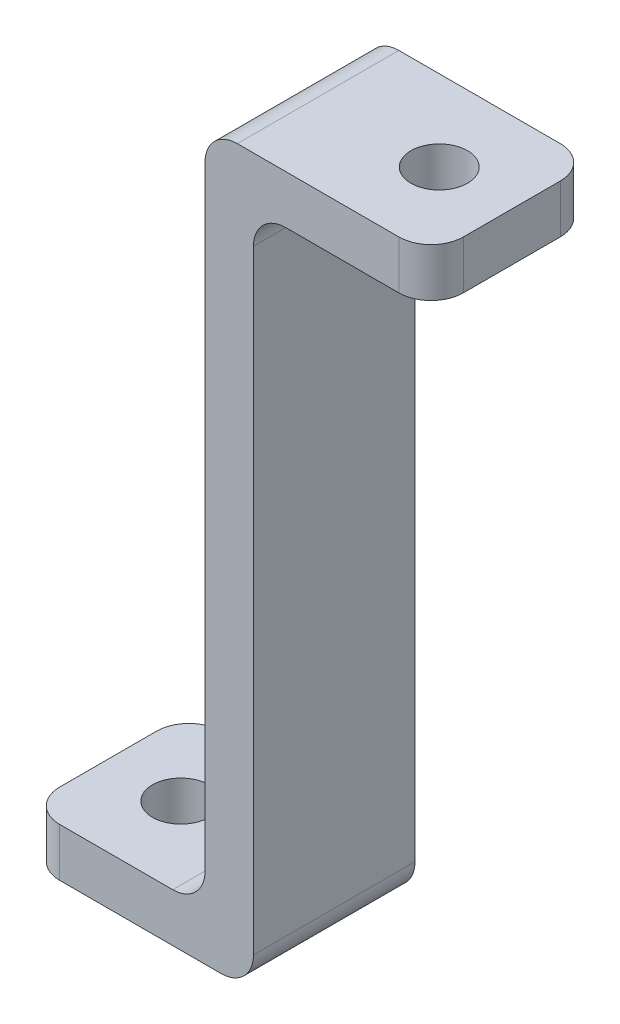
from build123d import *

# Parameters (mm, degrees)
BOSS_EXTRUDE1_DEPTH   = 10
FILLET1_R             = 2
F_3_0MM_DOWEL_HOLE1_D = 3.5
F_3_0MM_DOWEL_HOLE2_D = 3.5
FILLET2_R             = 2


with BuildPart() as part:
    # Sketch1 → Boss-Extrude1 (new body)
    with BuildSketch(Plane.XY):
        Polygon((0, 0), (14, 0), (14, 42), (25, 42), (25, 45), (11, 45), (11, 3), (0, 3), align=None)
    extrude(amount=-BOSS_EXTRUDE1_DEPTH)

    # Fillet1
    fillet1_edges = [part.edges().sort_by_distance(p)[0] for p in [
        (14, 0, -5),
        (11, 45, -5),
        (11, 3, -5),
        (14, 42, -5),
    ]]
    fillet(fillet1_edges, radius=FILLET1_R)

    # Ø3.0mm Dowel Hole1 (through all)
    with Locations(Plane(origin=(4.5, 0, -5), x_dir=(0, 0, -1), z_dir=(0, -1, 0))):
        with Locations((0, 0)):
            Hole(F_3_0MM_DOWEL_HOLE1_D / 2)

    # Ø3.0mm Dowel Hole2 (through all)
    with Locations(Plane(origin=(0, 45, 0), x_dir=(1, 0, 0), z_dir=(0, 1, 0))):
        with Locations((20.5, 5)):
            Hole(F_3_0MM_DOWEL_HOLE2_D / 2)

    # Fillet2
    fillet2_edges = [part.edges().sort_by_distance(p)[0] for p in [
        (25, 43.5, 0),
        (25, 43.5, -10),
        (0, 1.5, -10),
        (0, 1.5, 0),
    ]]
    fillet(fillet2_edges, radius=FILLET2_R)


solid = part.part
